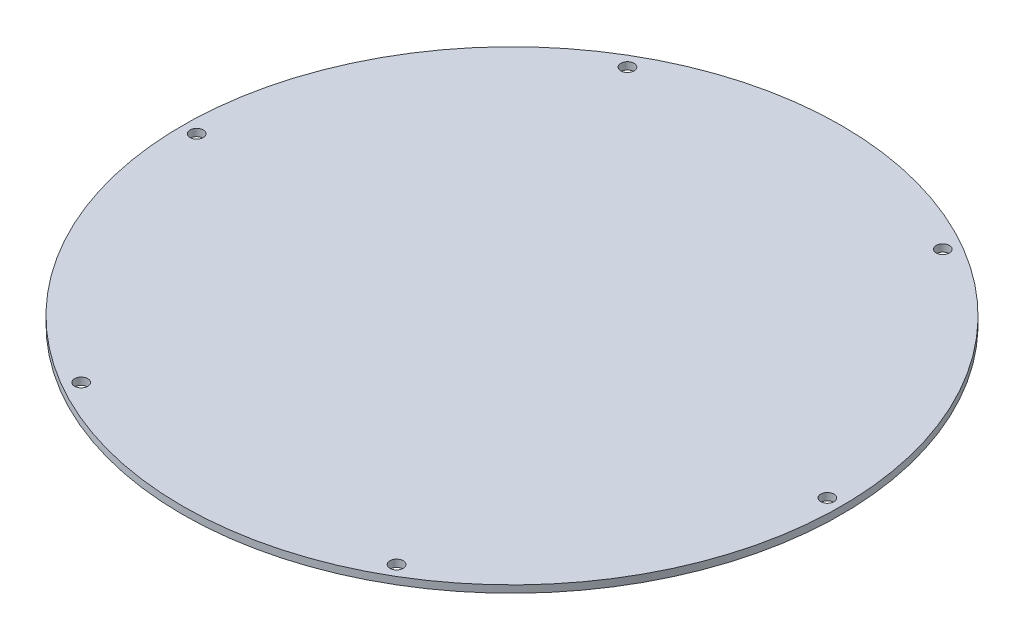
from build123d import *

# Parameters (mm, degrees)
SKETCH1_R                  = 52.25
BASE_FLANGE4_DEPTH         = 1.15
F_2_1_2_1_DIAMETER_HOLE2_D = 2.1


# Sheet-metal steps are written as plain solids
with BuildPart() as part:
    # Sketch1 → Base-Flange4 (new body)
    with BuildSketch(Plane(origin=(0, 0, 0), x_dir=(1, 0, 0), z_dir=(0, 1, 0))):
        with Locations(Location((0, 0, 0), (0, 0, 270))):
            Circle(SKETCH1_R)
    extrude(amount=BASE_FLANGE4_DEPTH)

    # Ø2.1 (2.1) Diameter Hole2 (through all)
    with Locations(Plane(origin=(0, 0, 0), x_dir=(-1, 0, 0), z_dir=(0, -1, 0))):
        with Locations((50, 0), (25, -43.301270189), (-25, -43.301270189), (-50, 0), (-25, 43.301270189), (25, 43.301270189)):
            Hole(F_2_1_2_1_DIAMETER_HOLE2_D / 2)


solid = part.part
